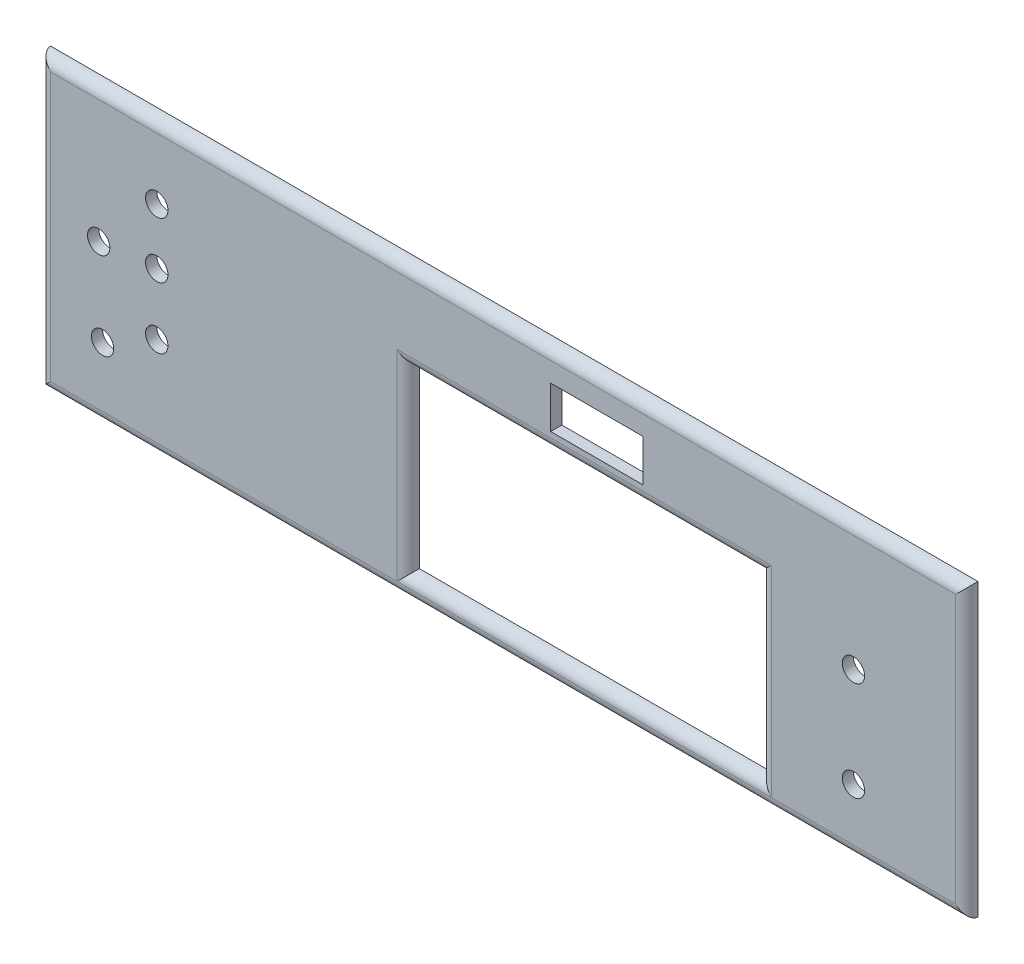
from build123d import *

# Parameters (mm, degrees)
SKICA1_W                 = 160
SKICA1_H                 = 46
SKICA1_R                 = 2
P_IDAT_VYSUNUT_M1_DEPTH  = 2
SKICA2_W                 = 166
SKICA2_H                 = 52
SKICA2_W_2               = 160
SKICA2_H_2               = 46
P_IDAT_VYSUNUT_M4_DEPTH  = 2
SKICA3_W                 = 63
SKICA3_H                 = 32
ODEBRAT_VYSUNUT_M1_DEPTH = 171.217507913
SKICA4_W                 = 16.5
SKICA4_H                 = 7.5
ODEBRAT_VYSUNUT_M2_DEPTH = 171.217507913
ZAOBLIT14_R              = 2
SKICA5_R                 = 2
ODEBRAT_VYSUNUT_M3_DEPTH = 171.217507913
ZAOBLIT16_R              = 2


with BuildPart() as part:
    # Skica1 → Přidat vysunutím1 (new body)
    with BuildSketch(Plane.XY):
        with Locations((80, 23)):
            Rectangle(SKICA1_W, SKICA1_H)
        with Locations((7.6, 25)):
            Circle(SKICA1_R, mode=Mode.SUBTRACT)
        with Locations((8.3, 9.7)):
            Circle(SKICA1_R, mode=Mode.SUBTRACT)
        with Locations((142.7, 26.2)):
            Circle(SKICA1_R, mode=Mode.SUBTRACT)
        with Locations((142.7, 8.4)):
            Circle(SKICA1_R, mode=Mode.SUBTRACT)
    extrude(amount=P_IDAT_VYSUNUT_M1_DEPTH)

    # Skica2 → Přidat vysunutím4 (add)
    with BuildSketch(Plane(origin=(0, 0, 0), x_dir=(-1, 0, 0), z_dir=(0, 0, -1))):
        with Locations((-80, 23)):
            Rectangle(SKICA2_W, SKICA2_H)
        with Locations((-80, 23)):
            Rectangle(SKICA2_W_2, SKICA2_H_2, mode=Mode.SUBTRACT)
    extrude(amount=-P_IDAT_VYSUNUT_M4_DEPTH)

    # Skica3 → Odebrat vysunutím1 (cut, through all)
    with BuildSketch(Plane.XY.offset(2)):
        with Locations((94.5, 17)):
            Rectangle(SKICA3_W, SKICA3_H)
    extrude(amount=-ODEBRAT_VYSUNUT_M1_DEPTH, mode=Mode.SUBTRACT)

    # Skica4 → Odebrat vysunutím2 (cut, through all)
    with BuildSketch(Plane.XY.offset(2)):
        with Locations((96.75, 39.75)):
            Rectangle(SKICA4_W, SKICA4_H)
    extrude(amount=-ODEBRAT_VYSUNUT_M2_DEPTH, mode=Mode.SUBTRACT)

    # Zaoblit14
    zaoblit14_edges = [part.edges().sort_by_distance(p)[0] for p in [
        (-3, 23, 2),
        (80, 49, 2),
        (80, -3, 2),
        (163, 23, 2),
    ]]
    fillet(zaoblit14_edges, radius=ZAOBLIT14_R - 0.0001)  # a hair under: the kernel refuses the full size

    # Skica5 → Odebrat vysunutím3 (cut, through all)
    with BuildSketch(Plane.XY.offset(2)):
        with Locations((18, 15)):
            Circle(SKICA5_R)
        with Locations((18, 26)):
            Circle(SKICA5_R)
        with Locations((18, 36)):
            Circle(SKICA5_R)
    extrude(amount=-ODEBRAT_VYSUNUT_M3_DEPTH, mode=Mode.SUBTRACT)

    # Zaoblit16
    zaoblit16_edges = [part.edges().sort_by_distance(p)[0] for p in [
        (94.5, 1, 2),
        (126, 17, 2),
        (94.5, 33, 2),
        (63, 17, 2),
    ]]
    fillet(zaoblit16_edges, radius=ZAOBLIT16_R - 0.0001)  # a hair under: the kernel refuses the full size


solid = part.part
